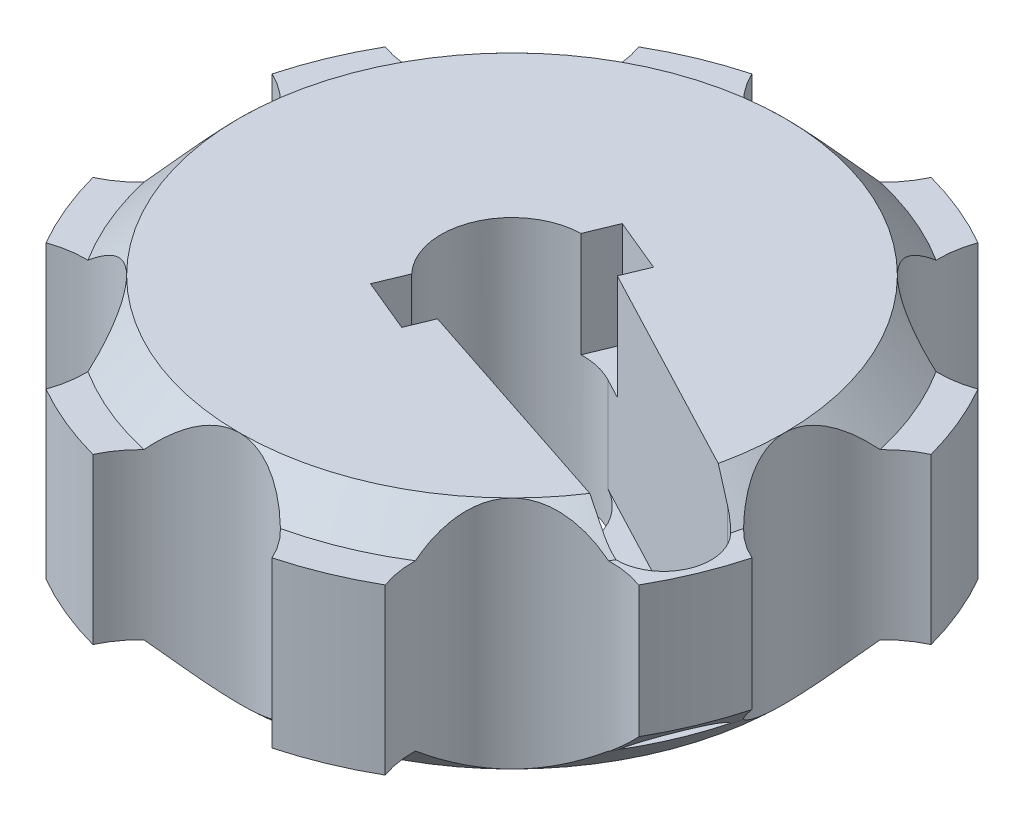
from build123d import *

# Parameters (mm, degrees)
SKETCH1_R           = 15.55551692
BOSS_EXTRUDE1_DEPTH = 9.4
BOSS_EXTRUDE2_START = 9.4
SKETCH1_4_R         = 15.55551692
BOSS_EXTRUDE2_DEPTH = 2
BOSS_EXTRUDE3_START = -2
SKETCH1_5_R         = 15.55551692
BOSS_EXTRUDE3_DEPTH = 2
CHAMFER2_SIZE       = 2
CUT_EXTRUDE1_DEPTH  = 11.4
CUT_EXTRUDE2_DEPTH  = 13.4
KEY_CUT_DEPTH       = 6
CHAMFER3_SIZE       = 1.9


with BuildPart() as part:
    # Sketch1 → Boss-Extrude1 (new body)
    with BuildSketch(Plane(origin=(0, 0, 0), x_dir=(1, 0, 0), z_dir=(0, 1, 0))):
        with BuildLine():
            ThreePointArc((-16.916819633, -9.681614935), (-13.766406033, -9.47966445), (-10.999411499, -10.999411499))
            ThreePointArc((-10.999411499, -10.999411499), (-14.371423694, -5.952838621), (-15.55551692, -3.1e-08))
            ThreePointArc((-15.55551692, -3.1e-08), (-16.437454083, -3.031184056), (-18.807933452, -5.116062305))
            ThreePointArc((-18.807933452, -5.116062305), (-18.007652913, -7.459014063), (-16.916819633, -9.681614935))
        make_face()
        with BuildLine():
            ThreePointArc((-5.116062305, -18.807933452), (-3.031184038, -16.437454071), (1.1e-08, -15.55551692))
            ThreePointArc((1.1e-08, -15.55551692), (-5.952838602, -14.371423702), (-10.999411499, -10.999411499))
            ThreePointArc((-10.999411499, -10.999411499), (-9.47966445, -13.766406033), (-9.681614935, -16.916819633))
            ThreePointArc((-9.681614935, -16.916819633), (-7.459014063, -18.007652913), (-5.116062305, -18.807933452))
        make_face()
        with BuildLine():
            ThreePointArc((1.1e-08, -15.55551692), (3.031184048, -16.437454078), (5.116062305, -18.807933452))
            ThreePointArc((5.116062305, -18.807933452), (7.459014063, -18.007652913), (9.681614935, -16.916819633))
            ThreePointArc((9.681614935, -16.916819633), (9.47966445, -13.766406033), (10.999411499, -10.999411499))
            ThreePointArc((10.999411499, -10.999411499), (5.952838612, -14.371423698), (1.1e-08, -15.55551692))
        make_face()
        Circle(SKETCH1_R)
        with BuildLine():
            ThreePointArc((15.55551692, 0), (14.3714237, -5.952838607), (10.999411499, -10.999411499))
            ThreePointArc((10.999411499, -10.999411499), (13.766406033, -9.47966445), (16.916819633, -9.681614935))
            ThreePointArc((16.916819633, -9.681614935), (18.007652913, -7.459014063), (18.807933452, -5.116062305))
            ThreePointArc((18.807933452, -5.116062305), (16.437454074, -3.031184043), (15.55551692, 0))
        make_face()
        with BuildLine():
            ThreePointArc((10.999411479, 10.999411519), (14.371423695, 5.95283862), (15.55551692, 0))
            ThreePointArc((15.55551692, 0), (16.437454074, 3.031184043), (18.807933452, 5.116062305))
            ThreePointArc((18.807933452, 5.116062305), (18.007652913, 7.459014063), (16.916819633, 9.681614935))
            ThreePointArc((16.916819633, 9.681614935), (13.76640602, 9.479664453), (10.999411479, 10.999411519))
        make_face()
        with BuildLine():
            ThreePointArc((-2e-09, 15.55551692), (5.952838593, 14.371423706), (10.999411479, 10.999411519))
            ThreePointArc((10.999411479, 10.999411519), (9.479664447, 13.766406047), (9.681614935, 16.916819633))
            ThreePointArc((9.681614935, 16.916819633), (7.459014063, 18.007652913), (5.116062305, 18.807933452))
            ThreePointArc((5.116062305, 18.807933452), (3.031184042, 16.437454074), (-2e-09, 15.55551692))
        make_face()
        with BuildLine():
            ThreePointArc((-9.681614935, 16.916819633), (-9.479664448, 13.766406042), (-10.999411487, 10.999411511))
            ThreePointArc((-10.999411487, 10.999411511), (-5.9528386, 14.371423703), (-2e-09, 15.55551692))
            ThreePointArc((-2e-09, 15.55551692), (-3.031184044, 16.437454075), (-5.116062305, 18.807933452))
            ThreePointArc((-5.116062305, 18.807933452), (-7.459014063, 18.007652913), (-9.681614935, 16.916819633))
        make_face()
        with BuildLine():
            ThreePointArc((-18.807933452, 5.116062305), (-16.437454066, 3.03118403), (-15.55551692, -3.1e-08))
            ThreePointArc((-15.55551692, -3.1e-08), (-14.371423703, 5.952838601), (-10.999411487, 10.999411511))
            ThreePointArc((-10.999411487, 10.999411511), (-13.766406025, 9.479664452), (-16.916819633, 9.681614935))
            ThreePointArc((-16.916819633, 9.681614935), (-18.007652913, 7.459014063), (-18.807933452, 5.116062305))
        make_face()
    extrude(amount=BOSS_EXTRUDE1_DEPTH)

    # Sketch1<4> → Boss-Extrude2 (add)
    with BuildSketch(Plane(origin=(0, 0, 0), x_dir=(1, 0, 0), z_dir=(0, 1, 0)).offset(BOSS_EXTRUDE2_START)):
        with Locations(Location((0, 0, 0), (0, 0, 270))):
            Circle(SKETCH1_4_R)
    extrude(amount=BOSS_EXTRUDE2_DEPTH)

    # Sketch1<5> → Boss-Extrude3 (add)
    with BuildSketch(Plane(origin=(0, 0, 0), x_dir=(1, 0, 0), z_dir=(0, 1, 0)).offset(BOSS_EXTRUDE3_START)):
        with Locations(Location((0, 0, 0), (0, 0, 270))):
            Circle(SKETCH1_5_R)
    extrude(amount=BOSS_EXTRUDE3_DEPTH)

    # Chamfer2
    # the kernel refuses this chamfer: 2 mm, written as the material it adds along each edge
    with BuildSketch(Plane(origin=(0, 9.4, 0), x_dir=(-0.7071067819532597, 0, 0.7071067804198353), z_dir=(-0.7071067804198353, 0, -0.7071067819532597))) as chamfer2_piece_1_section:
        Polygon((15.55551692, CHAMFER2_SIZE), (15.55551692 + CHAMFER2_SIZE, 0), (15.55551692, 0), align=None)
    chamfer2_piece_1 = revolve(axis=Axis((0, 9.4, 0), (0, 1, 0)), revolution_arc=45.000000062, mode=Mode.PRIVATE)
    chamfer2_piece_1 = chamfer2_piece_1 - Plane(origin=(-14.994564813, 10.103766753, 14.994564813), x_dir=(-0.3402220920568066, 0, -0.9403451111567975), z_dir=(0, -1, 0)) * Cylinder(5.65, 71, mode=Mode.PRIVATE)
    chamfer2_piece_1 = chamfer2_piece_1 - Plane(origin=(0, 10.103766753, 21.20551692), x_dir=(-0.9054977531574303, 0, -0.42435105635174936), z_dir=(0, -1, 0)) * Cylinder(5.65, 71, mode=Mode.PRIVATE)
    add(chamfer2_piece_1)
    with BuildSketch(Plane(origin=(0, 9.4, 0), x_dir=(-1.0, 0, 2.0490157005346928e-09), z_dir=(-2.0490157005346928e-09, 0, -1.0))) as chamfer2_piece_2_section:
        Polygon((15.55551692, CHAMFER2_SIZE), (15.55551692 + CHAMFER2_SIZE, 0), (15.55551692, 0), align=None)
    chamfer2_piece_2 = revolve(axis=Axis((0, 9.4, 0), (0, 1, 0)), revolution_arc=44.99999982, mode=Mode.PRIVATE)
    chamfer2_piece_2 = chamfer2_piece_2 - Plane(origin=(-21.20551692, 10.103766743, 0), x_dir=(1.0, 0, 5.4411098439037235e-09), z_dir=(0, -1, 0)) * Cylinder(5.65, 71, mode=Mode.PRIVATE)
    chamfer2_piece_2 = chamfer2_piece_2 - Plane(origin=(-14.994564813, 10.103766743, 14.994564813), x_dir=(-0.3402220920568066, 0, -0.9403451111567975), z_dir=(0, -1, 0)) * Cylinder(5.65, 71, mode=Mode.PRIVATE)
    add(chamfer2_piece_2)
    with BuildSketch(Plane(origin=(0, 9.4, 0), x_dir=(-0.7071067817625238, 0, -0.7071067806105713), z_dir=(0.7071067806105713, 0, -0.7071067817625238))) as chamfer2_piece_3_section:
        Polygon((15.55551692 + CHAMFER2_SIZE, 0), (15.55551692, CHAMFER2_SIZE), (15.55551692, 0), align=None)
    chamfer2_piece_3 = revolve(axis=Axis((0, 9.4, 0), (0, 1, 0)), revolution_arc=45.000000071, mode=Mode.PRIVATE)
    chamfer2_piece_3 = chamfer2_piece_3 - Plane(origin=(-14.994564813, 10.103766886, -14.994564813), x_dir=(0.9403451111567979, 0, -0.34022209205680554), z_dir=(0, -1, 0)) * Cylinder(5.65, 71, mode=Mode.PRIVATE)
    chamfer2_piece_3 = chamfer2_piece_3 - Plane(origin=(-21.20551692, 10.103766886, 0), x_dir=(1.0, 0, 5.4411098439037235e-09), z_dir=(0, -1, 0)) * Cylinder(5.65, 71, mode=Mode.PRIVATE)
    add(chamfer2_piece_3)
    with BuildSketch(Plane(origin=(0, 9.4, 0), x_dir=(1.1417875063861984e-10, 0, -1.0), z_dir=(1.0, 0, 1.1417875063861984e-10))) as chamfer2_piece_4_section:
        Polygon((15.55551692 + CHAMFER2_SIZE, 0), (15.55551692, CHAMFER2_SIZE), (15.55551692, 0), align=None)
    chamfer2_piece_4 = revolve(axis=Axis((0, 9.4, 0), (0, 1, 0)), revolution_arc=45.000000053, mode=Mode.PRIVATE)
    chamfer2_piece_4 = chamfer2_piece_4 - Plane(origin=(-14.994564813, 10.103766753, -14.994564813), x_dir=(0.9403451111567979, 0, -0.34022209205680554), z_dir=(0, -1, 0)) * Cylinder(5.65, 71, mode=Mode.PRIVATE)
    chamfer2_piece_4 = chamfer2_piece_4 - Plane(origin=(0, 10.103766753, -21.20551692), x_dir=(0.9054977531574306, 0, 0.4243510563517486), z_dir=(0, -1, 0)) * Cylinder(5.65, 71, mode=Mode.PRIVATE)
    add(chamfer2_piece_4)
    with BuildSketch(Plane(origin=(0, 9.4, 0), x_dir=(0.7071067822725222, 0, -0.7071067801005728), z_dir=(0.7071067801005728, 0, 0.7071067822725222))) as chamfer2_piece_5_section:
        Polygon((15.55551692, CHAMFER2_SIZE), (15.55551692 + CHAMFER2_SIZE, 0), (15.55551692, 0), align=None)
    chamfer2_piece_5 = revolve(axis=Axis((0, 9.4, 0), (0, 1, 0)), revolution_arc=45.000000081, mode=Mode.PRIVATE)
    chamfer2_piece_5 = chamfer2_piece_5 - Plane(origin=(0, 10.103766753, -21.20551692), x_dir=(0.9054977531574306, 0, 0.4243510563517486), z_dir=(0, -1, 0)) * Cylinder(5.65, 71, mode=Mode.PRIVATE)
    chamfer2_piece_5 = chamfer2_piece_5 - Plane(origin=(14.994564813, 10.103766753, -14.994564813), x_dir=(0.3402220920568063, 0, 0.9403451111567976), z_dir=(0, -1, 0)) * Cylinder(5.65, 71, mode=Mode.PRIVATE)
    add(chamfer2_piece_5)
    with BuildSketch(Plane(origin=(0, 9.4, 0), x_dir=(1.0, 0, 4.268254867465012e-10), z_dir=(-4.268254867465012e-10, 0, 1.0))) as chamfer2_piece_6_section:
        Polygon((15.55551692, CHAMFER2_SIZE), (15.55551692 + CHAMFER2_SIZE, 0), (15.55551692, 0), align=None)
    chamfer2_piece_6 = revolve(axis=Axis((0, 9.4, 0), (0, 1, 0)), revolution_arc=44.999999936, mode=Mode.PRIVATE)
    chamfer2_piece_6 = chamfer2_piece_6 - Plane(origin=(14.994564813, 10.103766753, -14.994564813), x_dir=(0.3402220920568063, 0, 0.9403451111567976), z_dir=(0, -1, 0)) * Cylinder(5.65, 71, mode=Mode.PRIVATE)
    chamfer2_piece_6 = chamfer2_piece_6 - Plane(origin=(21.20551692, 10.103766753, 0), x_dir=(-0.42435105635174664, 0, 0.9054977531574315), z_dir=(0, -1, 0)) * Cylinder(5.65, 71, mode=Mode.PRIVATE)
    add(chamfer2_piece_6)
    with BuildSketch(Plane(origin=(0, 9.4, 0), x_dir=(0.7071067799459831, 0, 0.7071067824271119), z_dir=(-0.7071067824271119, 0, 0.7071067799459831))) as chamfer2_piece_7_section:
        Polygon((15.55551692, CHAMFER2_SIZE), (15.55551692 + CHAMFER2_SIZE, 0), (15.55551692, 0), align=None)
    chamfer2_piece_7 = revolve(axis=Axis((0, 9.4, 0), (0, 1, 0)), revolution_arc=45.000000076, mode=Mode.PRIVATE)
    chamfer2_piece_7 = chamfer2_piece_7 - Plane(origin=(14.994564813, 10.103766753, 14.994564813), x_dir=(-0.9403451111567976, 0, 0.34022209205680604), z_dir=(0, -1, 0)) * Cylinder(5.65, 71, mode=Mode.PRIVATE)
    chamfer2_piece_7 = chamfer2_piece_7 - Plane(origin=(21.20551692, 10.103766753, 0), x_dir=(-0.42435105635174664, 0, 0.9054977531574315), z_dir=(0, -1, 0)) * Cylinder(5.65, 71, mode=Mode.PRIVATE)
    add(chamfer2_piece_7)
    with BuildSketch(Plane(origin=(0, 9.4, 0), x_dir=(0, 0, 1), z_dir=(-1, 0, 0))) as chamfer2_piece_8_section:
        Polygon((15.55551692, CHAMFER2_SIZE), (15.55551692 + CHAMFER2_SIZE, 0), (15.55551692, 0), align=None)
    chamfer2_piece_8 = revolve(axis=Axis((0, 9.4, 0), (0, 1, 0)), revolution_arc=44.999999899, mode=Mode.PRIVATE)
    chamfer2_piece_8 = chamfer2_piece_8 - Plane(origin=(14.994564813, 10.103766753, 14.994564813), x_dir=(-0.9403451111567976, 0, 0.34022209205680604), z_dir=(0, -1, 0)) * Cylinder(5.65, 71, mode=Mode.PRIVATE)
    chamfer2_piece_8 = chamfer2_piece_8 - Plane(origin=(0, 10.103766753, 21.20551692), x_dir=(-0.9054977531574303, 0, -0.42435105635174936), z_dir=(0, -1, 0)) * Cylinder(5.65, 71, mode=Mode.PRIVATE)
    add(chamfer2_piece_8)
    with BuildSketch(Plane(origin=(0, 0, 0), x_dir=(-0.7071067819532592, 0, 0.707106780419836), z_dir=(-0.707106780419836, 0, -0.7071067819532592))) as chamfer2_piece_9_section:
        Polygon((15.55551692, -CHAMFER2_SIZE), (15.55551692 + CHAMFER2_SIZE, 0), (15.55551692, 0), align=None)
    chamfer2_piece_9 = revolve(axis=Axis((0, 0, 0), (0, 1, 0)), revolution_arc=45.000000062, mode=Mode.PRIVATE)
    chamfer2_piece_9 = chamfer2_piece_9 - Plane(origin=(-14.994564813, -0.703766753, 14.994564813), x_dir=(-0.3402220920568066, 0, -0.9403451111567975), z_dir=(0, -1, 0)) * Cylinder(5.65, 71, mode=Mode.PRIVATE)
    chamfer2_piece_9 = chamfer2_piece_9 - Plane(origin=(0, -0.703766753, 21.20551692), x_dir=(-0.9054977531574303, 0, -0.42435105635174936), z_dir=(0, -1, 0)) * Cylinder(5.65, 71, mode=Mode.PRIVATE)
    add(chamfer2_piece_9)
    with BuildSketch(Plane(origin=(0, 0, 0), x_dir=(-1.0, 0, 7.725603147000415e-10), z_dir=(-7.725603147000415e-10, 0, -1.0))) as chamfer2_piece_10_section:
        Polygon((15.55551692, -CHAMFER2_SIZE), (15.55551692 + CHAMFER2_SIZE, 0), (15.55551692, 0), align=None)
    chamfer2_piece_10 = revolve(axis=Axis((0, 0, 0), (0, 1, 0)), revolution_arc=44.999999894, mode=Mode.PRIVATE)
    chamfer2_piece_10 = chamfer2_piece_10 - Plane(origin=(-21.20551692, -0.703766743, 0), x_dir=(1.0, 0, 5.4411098439037235e-09), z_dir=(0, -1, 0)) * Cylinder(5.65, 71, mode=Mode.PRIVATE)
    chamfer2_piece_10 = chamfer2_piece_10 - Plane(origin=(-14.994564813, -0.703766743, 14.994564813), x_dir=(-0.3402220920568066, 0, -0.9403451111567975), z_dir=(0, -1, 0)) * Cylinder(5.65, 71, mode=Mode.PRIVATE)
    add(chamfer2_piece_10)
    with BuildSketch(Plane(origin=(0, 0, 0), x_dir=(-0.7071067817031288, 0, -0.7071067806699662), z_dir=(0.7071067806699662, 0, -0.7071067817031288))) as chamfer2_piece_11_section:
        Polygon((15.55551692 + CHAMFER2_SIZE, 0), (15.55551692, -CHAMFER2_SIZE), (15.55551692, 0), align=None)
    chamfer2_piece_11 = revolve(axis=Axis((0, 0, 0), (0, 1, 0)), revolution_arc=45.000000002, mode=Mode.PRIVATE)
    chamfer2_piece_11 = chamfer2_piece_11 - Plane(origin=(-14.994564813, -0.703766886, -14.994564813), x_dir=(0.9403451111567979, 0, -0.34022209205680554), z_dir=(0, -1, 0)) * Cylinder(5.65, 71, mode=Mode.PRIVATE)
    chamfer2_piece_11 = chamfer2_piece_11 - Plane(origin=(-21.20551692, -0.703766886, 0), x_dir=(1.0, 0, 5.4411098439037235e-09), z_dir=(0, -1, 0)) * Cylinder(5.65, 71, mode=Mode.PRIVATE)
    add(chamfer2_piece_11)
    with BuildSketch(Plane(origin=(0, 0, 0), x_dir=(-5.915567194248534e-10, 0, -1.0), z_dir=(1.0, 0, -5.915567194248534e-10))) as chamfer2_piece_12_section:
        Polygon((15.55551692 + CHAMFER2_SIZE, 0), (15.55551692, -CHAMFER2_SIZE), (15.55551692, 0), align=None)
    chamfer2_piece_12 = revolve(axis=Axis((0, 0, 0), (0, 1, 0)), revolution_arc=45.000000008, mode=Mode.PRIVATE)
    chamfer2_piece_12 = chamfer2_piece_12 - Plane(origin=(-14.994564813, -0.703766753, -14.994564813), x_dir=(0.9403451111567979, 0, -0.34022209205680554), z_dir=(0, -1, 0)) * Cylinder(5.65, 71, mode=Mode.PRIVATE)
    chamfer2_piece_12 = chamfer2_piece_12 - Plane(origin=(0, -0.703766753, -21.20551692), x_dir=(0.9054977531574306, 0, 0.4243510563517486), z_dir=(0, -1, 0)) * Cylinder(5.65, 71, mode=Mode.PRIVATE)
    add(chamfer2_piece_12)
    with BuildSketch(Plane(origin=(0, 0, 0), x_dir=(0.7071067803065033, 0, -0.7071067820665917), z_dir=(0.7071067820665917, 0, 0.7071067803065033))) as chamfer2_piece_13_section:
        Polygon((15.55551692, -CHAMFER2_SIZE), (15.55551692 + CHAMFER2_SIZE, 0), (15.55551692, 0), align=None)
    chamfer2_piece_13 = revolve(axis=Axis((0, 0, 0), (0, 1, 0)), revolution_arc=44.999999963, mode=Mode.PRIVATE)
    chamfer2_piece_13 = chamfer2_piece_13 - Plane(origin=(0, -0.703766753, -21.20551692), x_dir=(0.9054977531574306, 0, 0.4243510563517486), z_dir=(0, -1, 0)) * Cylinder(5.65, 71, mode=Mode.PRIVATE)
    chamfer2_piece_13 = chamfer2_piece_13 - Plane(origin=(14.994564813, -0.703766753, -14.994564813), x_dir=(0.3402220920568063, 0, 0.9403451111567976), z_dir=(0, -1, 0)) * Cylinder(5.65, 71, mode=Mode.PRIVATE)
    add(chamfer2_piece_13)
    with BuildSketch(Plane(origin=(0, 0, 0), x_dir=(1.0, 0, 2.989517751270151e-10), z_dir=(-2.989517751270151e-10, 0, 1.0))) as chamfer2_piece_14_section:
        Polygon((15.55551692, -CHAMFER2_SIZE), (15.55551692 + CHAMFER2_SIZE, 0), (15.55551692, 0), align=None)
    chamfer2_piece_14 = revolve(axis=Axis((0, 0, 0), (0, 1, 0)), revolution_arc=45.000000088, mode=Mode.PRIVATE)
    chamfer2_piece_14 = chamfer2_piece_14 - Plane(origin=(14.994564813, -0.703766753, -14.994564813), x_dir=(0.3402220920568063, 0, 0.9403451111567976), z_dir=(0, -1, 0)) * Cylinder(5.65, 71, mode=Mode.PRIVATE)
    chamfer2_piece_14 = chamfer2_piece_14 - Plane(origin=(21.20551692, -0.703766753, 0), x_dir=(-0.42435105635174664, 0, 0.9054977531574315), z_dir=(0, -1, 0)) * Cylinder(5.65, 71, mode=Mode.PRIVATE)
    add(chamfer2_piece_14)
    with BuildSketch(Plane(origin=(0, 0, 0), x_dir=(0.7071067811865478, 0, 0.7071067811865472), z_dir=(-0.7071067811865472, 0, 0.7071067811865478))) as chamfer2_piece_15_section:
        Polygon((15.55551692, -CHAMFER2_SIZE), (15.55551692 + CHAMFER2_SIZE, 0), (15.55551692, 0), align=None)
    chamfer2_piece_15 = revolve(axis=Axis((0, 0, 0), (0, 1, 0)), revolution_arc=44.999999983, mode=Mode.PRIVATE)
    chamfer2_piece_15 = chamfer2_piece_15 - Plane(origin=(14.994564813, -0.703766753, 14.994564813), x_dir=(-0.9403451111567976, 0, 0.34022209205680604), z_dir=(0, -1, 0)) * Cylinder(5.65, 71, mode=Mode.PRIVATE)
    chamfer2_piece_15 = chamfer2_piece_15 - Plane(origin=(21.20551692, -0.703766753, 0), x_dir=(-0.42435105635174664, 0, 0.9054977531574315), z_dir=(0, -1, 0)) * Cylinder(5.65, 71, mode=Mode.PRIVATE)
    add(chamfer2_piece_15)
    with BuildSketch(Plane(origin=(0, 0, 0), x_dir=(0, 0, 1), z_dir=(-1, 0, 0))) as chamfer2_piece_16_section:
        Polygon((15.55551692, -CHAMFER2_SIZE), (15.55551692 + CHAMFER2_SIZE, 0), (15.55551692, 0), align=None)
    chamfer2_piece_16 = revolve(axis=Axis((0, 0, 0), (0, 1, 0)), revolution_arc=45, mode=Mode.PRIVATE)
    chamfer2_piece_16 = chamfer2_piece_16 - Plane(origin=(14.994564813, -0.703766753, 14.994564813), x_dir=(-0.9403451111567976, 0, 0.34022209205680604), z_dir=(0, -1, 0)) * Cylinder(5.65, 71, mode=Mode.PRIVATE)
    chamfer2_piece_16 = chamfer2_piece_16 - Plane(origin=(0, -0.703766753, 21.20551692), x_dir=(-0.9054977531574303, 0, -0.42435105635174936), z_dir=(0, -1, 0)) * Cylinder(5.65, 71, mode=Mode.PRIVATE)
    add(chamfer2_piece_16)

    # Sketch2 → Cut-Extrude1 (cut)
    with BuildSketch(Plane(origin=(0, 11.4, 0), x_dir=(1, 0, 0), z_dir=(0, 1, 0))):
        with BuildLine():
            ThreePointArc((1.884877746, 3.584652826), (3.728044656, -1.58246107), (-1.269237344, -3.845976672))
            Line((-1.269237344, -3.845976672), (14.204096124, -8.952438399))
            ThreePointArc((14.204096124, -8.952438399), (17.535617458, -7.443427998), (16.306839518, -3.9986854))
            Line((16.306839518, -3.9986854), (1.884877746, 3.584652826))
        make_face()
        with BuildLine():
            ThreePointArc((1.884877746, 3.584652826), (-3.728044656, 1.58246107), (-1.269237344, -3.845976672))
            ThreePointArc((-1.269237344, -3.845976672), (3.728044656, -1.58246107), (1.884877746, 3.584652826))
        make_face()
    extrude(amount=-CUT_EXTRUDE1_DEPTH, mode=Mode.SUBTRACT)

    # Sketch2<3> → Cut-Extrude2 (cut)
    with BuildSketch(Plane(origin=(0, 11.4, 0), x_dir=(1, 0, 0), z_dir=(0, 1, 0))):
        with BuildLine():
            ThreePointArc((-1.269237344, -3.845976672), (3.728044656, -1.58246107), (1.884877746, 3.584652826))
            ThreePointArc((1.884877746, 3.584652826), (-3.728044656, 1.58246107), (-1.269237344, -3.845976672))
        make_face()
    extrude(amount=-CUT_EXTRUDE2_DEPTH, mode=Mode.SUBTRACT)

    # Shaft Key → Key-Cut (cut)
    with BuildSketch(Plane(origin=(0, 11.4, 0), x_dir=(1, 0, 0), z_dir=(0, 1, 0))):
        with BuildLine():
            Line((0.805658984, -2.366624939), (-0.580357649, -5.712765092))
            Line((-0.580357649, -5.712765092), (-3.629160107, -4.449909765))
            Line((-3.629160107, -4.449909765), (-2.243143474, -1.103769612))
            ThreePointArc((-2.243143474, -1.103769612), (-2.309698831, 0.956708581), (-0.805658984, 2.366624939))
            Line((-0.805658984, 2.366624939), (0.580357649, 5.712765092))
            Line((0.580357649, 5.712765092), (3.629160107, 4.449909765))
            Line((3.629160107, 4.449909765), (2.243143474, 1.103769612))
            ThreePointArc((2.243143474, 1.103769612), (2.309698831, -0.956708581), (0.805658984, -2.366624939))
        make_face()
    extrude(amount=-KEY_CUT_DEPTH, mode=Mode.SUBTRACT)

    # Chamfer3
    # the kernel refuses this chamfer: 1.9 mm, written as the material it takes off along each edge
    with BuildSketch(Plane(origin=(0, 0, 0), x_dir=(0.7175651173360041, 0, 0.696491423050253), z_dir=(-0.696491423050253, 0, 0.7175651173360041))) as chamfer3_piece_1:
        Polygon((19.491343059, CHAMFER3_SIZE), (19.491343059 - CHAMFER3_SIZE, 0), (19.491343059, 0), align=None)
    revolve(axis=Axis((0, 0, 0), (0, 1, 0)), revolution_arc=43.292367627, mode=Mode.SUBTRACT)


solid = part.part
